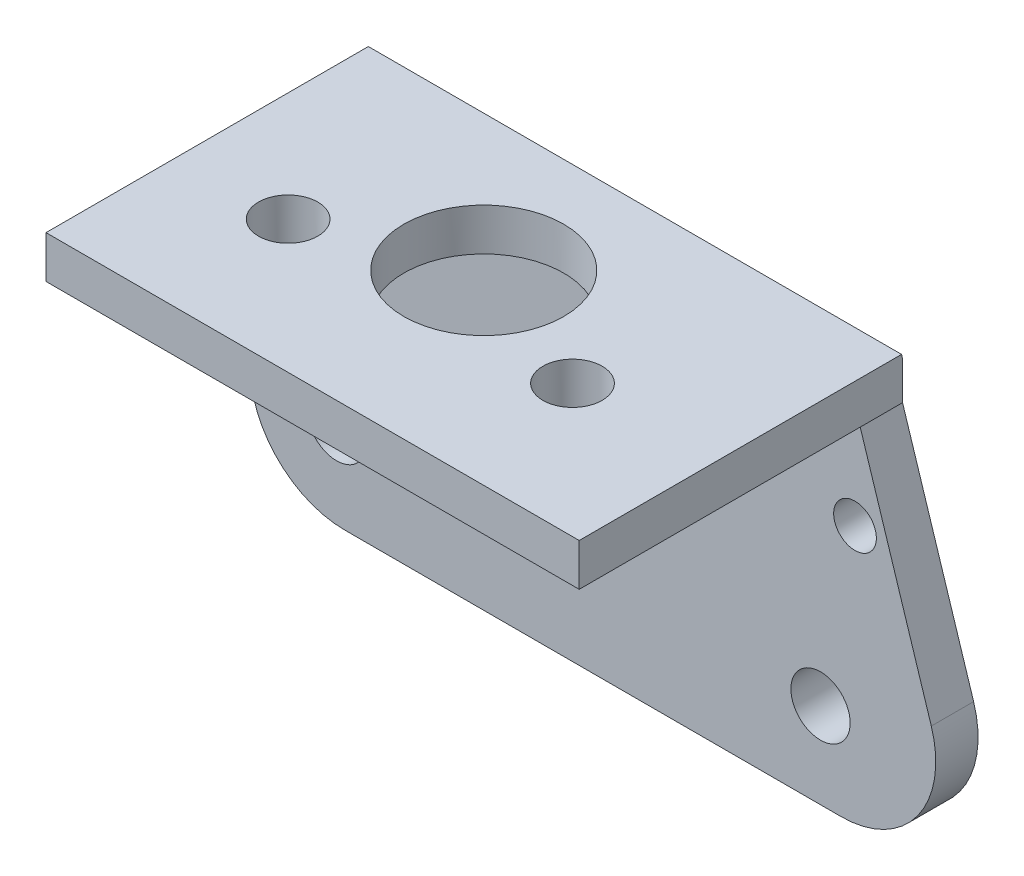
from build123d import *

# Parameters (mm, degrees)
BOSS_EXTRUDE1_DEPTH              = 3.571875
SKETCH2_W                        = 45
SKETCH2_H                        = 3.571875
BOSS_EXTRUDE2_DEPTH              = 23.714964
F_5_0_5_DIAMETER_HOLE1_D         = 5
F_5_0_5_DIAMETER_HOLE1_DEPTH     = 27.286839
FILLET1_R                        = 2
F_13_5_13_5_DIAMETER_HOLE1_D     = 13.5
F_13_5_13_5_DIAMETER_HOLE1_DEPTH = 34.276761893
F_5_0_5_DIAMETER_HOLE2_D         = 5
F_5_0_5_DIAMETER_HOLE2_DEPTH     = 34.276761893
SKETCH9_W                        = 45
SKETCH9_H                        = 1.428125
CUT_EXTRUDE1_DEPTH               = 10
SKETCH10_R                       = 1.8034
CUT_EXTRUDE2_DEPTH               = 49.252501701


with BuildPart() as part:
    # Sketch1 → Boss-Extrude1 (new body)
    with BuildSketch(Plane.XY.offset(5)):
        with BuildLine():
            Line((-21.229980824, 0), (-27.336443266, -18.80609256))
            ThreePointArc((-27.336443266, -18.80609256), (-26.199197486, -25.979667662), (-19.727514758, -29.276761893))
            Line((-19.727514758, -29.276761893), (22.145905459, -29.276761893))
            ThreePointArc((22.145905459, -29.276761893), (28.60379109, -25.99859556), (29.769170906, -18.850690187))
            Line((29.769170906, -18.850690187), (23.770019176, 0))
            Line((23.770019176, 0), (23.770019176, 5))
            Line((23.770019176, 5), (-21.229980824, 5))
            Line((-21.229980824, 5), (-21.229980824, 0))
        make_face()
    extrude(amount=-BOSS_EXTRUDE1_DEPTH)

    # Sketch2 → Boss-Extrude2 (add)
    with BuildSketch(Plane.XY.offset(5)):
        with Locations((1.270019176, 1.7859375)):
            Rectangle(SKETCH2_W, SKETCH2_H)
    extrude(amount=BOSS_EXTRUDE2_DEPTH)

    # Ø5.0 (5) Diameter Hole1
    with Locations(Plane(origin=(0, 0, 1.428125), x_dir=(-1, 0, 0), z_dir=(0, 0, -1))):
        with Locations((-20.42, -22.057021037), (20.42, -22.057021037)):
            Hole(F_5_0_5_DIAMETER_HOLE1_D / 2, depth=F_5_0_5_DIAMETER_HOLE1_DEPTH)

    # Fillet1
    fillet1_edges = [part.edges().sort_by_distance(p)[0] for p in [
        (1.270019176, 5, 1.428125),
    ]]
    fillet(fillet1_edges, radius=FILLET1_R)

    # Ø13.5 (13.5) Diameter Hole1
    with Locations(Plane(origin=(0, 5, 0), x_dir=(1, 0, 0), z_dir=(0, 1, 0))):
        with Locations((0, -13)):
            Hole(F_13_5_13_5_DIAMETER_HOLE1_D / 2, depth=F_13_5_13_5_DIAMETER_HOLE1_DEPTH)

    # Ø5.0 (5) Diameter Hole2
    with Locations(Plane(origin=(0, 5, 0), x_dir=(1, 0, 0), z_dir=(0, 1, 0))):
        with Locations((-12, -17.51), (12, -17.51)):
            Hole(F_5_0_5_DIAMETER_HOLE2_D / 2, depth=F_5_0_5_DIAMETER_HOLE2_DEPTH)

    # Sketch9 → Cut-Extrude1 (cut)
    with BuildSketch(Plane.XY.offset(5)):
        with Locations((1.270019176, 4.2859375)):
            Rectangle(SKETCH9_W, SKETCH9_H)
    extrude(amount=-CUT_EXTRUDE1_DEPTH, mode=Mode.SUBTRACT)

    # Sketch10 → Cut-Extrude2 (cut, through all)
    with BuildSketch(Plane.XY.offset(5)):
        with Locations((23.330050049, -7.435057613)):
            Circle(SKETCH10_R)
        with Locations((-20.888731092, -7.435057613)):
            Circle(SKETCH10_R)
    extrude(amount=-CUT_EXTRUDE2_DEPTH, mode=Mode.SUBTRACT)


solid = part.part
